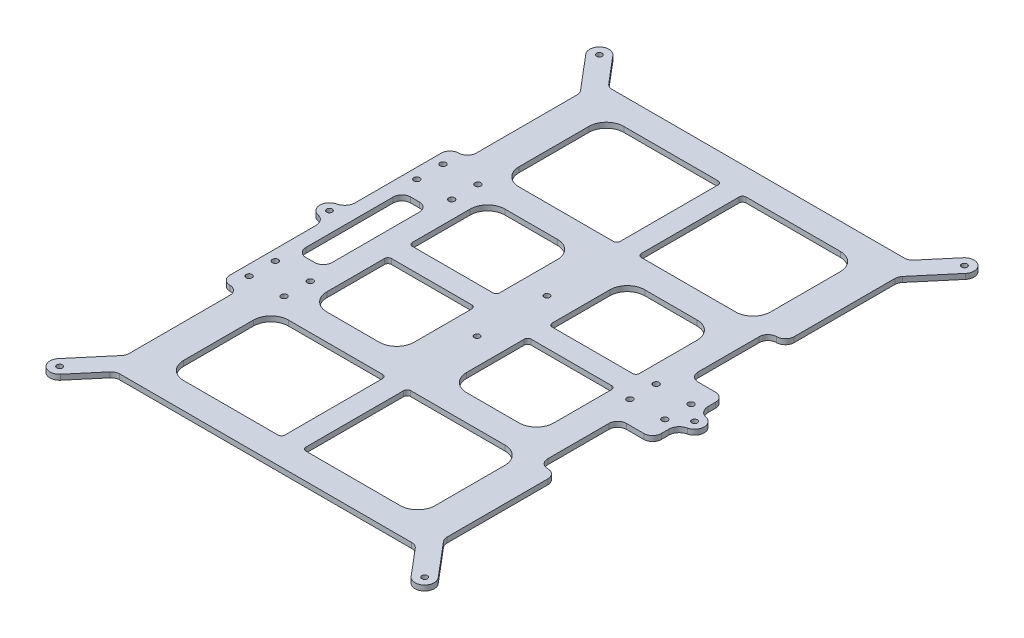
from build123d import *

# Parameters (mm, degrees)
CROQUIS1_W              = 220
CROQUIS1_H              = 320
CROQUIS1_R              = 1.7
CROQUIS1_R_2            = 1.6
SALIENTE_EXTRUIR1_DEPTH = 3
CROQUIS2_OUTSIDE_W      = 299.668
CROQUIS2_OUTSIDE_H      = 399.668
CORTAR_EXTRUIR1_DEPTH   = 3
REDONDEO1_R             = 5
CROQUIS3_W              = 20
CROQUIS3_H              = 45
CORTAR_EXTRUIR2_DEPTH   = 3
CROQUIS4_W              = 15
CROQUIS4_H              = 60
CORTAR_EXTRUIR3_DEPTH   = 3
REDONDEO2_R             = 5


with BuildPart() as part:
    # Croquis1 → Saliente-Extruir1 (new body)
    with BuildSketch(Plane(origin=(0, 0, 0), x_dir=(1, 0, 0), z_dir=(0, 1, 0))):
        with Locations((110, 160)):
            Rectangle(CROQUIS1_W, CROQUIS1_H)
        with Locations(Location((185, 167.5, 0), (0, 0, 270))):
            Circle(CROQUIS1_R, mode=Mode.SUBTRACT)
        with Locations(Location((205, 167.5, 0), (0, 0, 270))):
            Circle(CROQUIS1_R, mode=Mode.SUBTRACT)
        with Locations(Location((185, 152.5, 0), (0, 0, 90))):
            Circle(CROQUIS1_R, mode=Mode.SUBTRACT)
        with Locations(Location((205, 152.5, 0), (0, 0, 90))):
            Circle(CROQUIS1_R, mode=Mode.SUBTRACT)
        with Locations(Location((35, 215.5, 0), (0, 0, 270))):
            Circle(CROQUIS1_R, mode=Mode.SUBTRACT)
        with Locations(Location((35, 200.5, 0), (0, 0, 270))):
            Circle(CROQUIS1_R, mode=Mode.SUBTRACT)
        with Locations(Location((35, 119.5, 0), (0, 0, 90))):
            Circle(CROQUIS1_R, mode=Mode.SUBTRACT)
        with Locations(Location((35, 104.5, 0), (0, 0, 90))):
            Circle(CROQUIS1_R, mode=Mode.SUBTRACT)
        with Locations(Location((5.5, 314.5, 0), (0, 0, 270))):
            Circle(CROQUIS1_R_2, mode=Mode.SUBTRACT)
        with Locations(Location((214.5, 314.5, 0), (0, 0, 90))):
            Circle(CROQUIS1_R_2, mode=Mode.SUBTRACT)
        with Locations(Location((214.5, 5.5, 0), (0, 0, 270))):
            Circle(CROQUIS1_R_2, mode=Mode.SUBTRACT)
        with Locations(Location((5.5, 5.5, 0), (0, 0, 90))):
            Circle(CROQUIS1_R_2, mode=Mode.SUBTRACT)
        with Locations(Location((15, 200.5, 0), (0, 0, 90))):
            Circle(CROQUIS1_R, mode=Mode.SUBTRACT)
        with Locations(Location((15, 215.5, 0), (0, 0, 90))):
            Circle(CROQUIS1_R, mode=Mode.SUBTRACT)
        with Locations(Location((15, 104.5, 0), (0, 0, 270))):
            Circle(CROQUIS1_R, mode=Mode.SUBTRACT)
        with Locations(Location((15, 119.5, 0), (0, 0, 270))):
            Circle(CROQUIS1_R, mode=Mode.SUBTRACT)
        with Locations(Location((110, 180, 0), (0, 0, 270))):
            Circle(CROQUIS1_R_2, mode=Mode.SUBTRACT)
        with Locations(Location((110, 140, 0), (0, 0, 90))):
            Circle(CROQUIS1_R_2, mode=Mode.SUBTRACT)
        with Locations(Location((5.5, 160, 0), (0, 0, 270))):
            Circle(CROQUIS1_R_2, mode=Mode.SUBTRACT)
        with Locations(Location((214.5, 160, 0), (0, 0, 90))):
            Circle(CROQUIS1_R_2, mode=Mode.SUBTRACT)
    extrude(amount=SALIENTE_EXTRUIR1_DEPTH)

    # Croquis2 outside → Cortar-Extruir1 (cut)
    # profile 1 of 9: a face of its own
    with BuildSketch(Plane(origin=(0, 3, 0), x_dir=(1, 0, 0), z_dir=(0, 1, 0))):
        with Locations((110, 160)):
            Rectangle(CROQUIS2_OUTSIDE_W, CROQUIS2_OUTSIDE_H)
        with BuildLine():
            Line((9, 148.77502784), (9, 94.5))
            Line((9, 94.5), (19, 94.5))
            Line((19, 94.5), (19, 30))
            Line((19, 30), (1.298802547, 9.049639413))
            ThreePointArc((1.298802547, 9.049639413), (1.950360587, 1.298802547), (9.701197453, 1.950360587))
            Line((9.701197453, 1.950360587), (24.106631311, 19))
            Line((24.106631311, 19), (195.893368689, 19))
            Line((195.893368689, 19), (210.298802547, 1.950360587))
            ThreePointArc((210.298802547, 1.950360587), (218.049639413, 1.298802547), (218.701197453, 9.049639413))
            Line((218.701197453, 9.049639413), (201, 30))
            Line((201, 30), (201, 94.5))
            Line((201, 94.5), (211, 94.5))
            Line((211, 94.5), (211, 148.77502784))
            ThreePointArc((211, 148.77502784), (212.318863014, 152.528287293), (215.695652174, 154.631535054))
            ThreePointArc((215.695652174, 154.631535054), (220, 160), (215.695652174, 165.368464946))
            ThreePointArc((215.695652174, 165.368464946), (212.318863014, 167.471712707), (211, 171.22497216))
            Line((211, 171.22497216), (211, 225.5))
            Line((211, 225.5), (201, 225.5))
            Line((201, 225.5), (201, 290))
            Line((201, 290), (218.701197453, 310.950360587))
            ThreePointArc((218.701197453, 310.950360587), (218.049639413, 318.701197453), (210.298802547, 318.049639413))
            Line((210.298802547, 318.049639413), (195.893368689, 301))
            Line((195.893368689, 301), (24.106631311, 301))
            Line((24.106631311, 301), (9.701197453, 318.049639413))
            ThreePointArc((9.701197453, 318.049639413), (1.950360587, 318.701197453), (1.298802547, 310.950360587))
            Line((1.298802547, 310.950360587), (19, 290))
            Line((19, 290), (19, 225.5))
            Line((19, 225.5), (9, 225.5))
            Line((9, 225.5), (9, 171.22497216))
            ThreePointArc((9, 171.22497216), (7.681136986, 167.471712707), (4.304347826, 165.368464946))
            ThreePointArc((4.304347826, 165.368464946), (0, 160), (4.304347826, 154.631535054))
            ThreePointArc((4.304347826, 154.631535054), (7.681136986, 152.528287293), (9, 148.77502784))
        make_face(mode=Mode.SUBTRACT)
    # profile 2 of 9: a face of its own
    with BuildSketch(Plane(origin=(0, 3, 0), x_dir=(1, 0, 0), z_dir=(0, 1, 0))):
        with BuildLine():
            Line((182, 276), (182, 236))
            ThreePointArc((182, 236), (179.071067812, 228.928932188), (172, 226))
            Line((172, 226), (118, 226))
            ThreePointArc((118, 226), (116.585786438, 226.585786438), (116, 228))
            Line((116, 228), (116, 284))
            ThreePointArc((116, 284), (116.585786438, 285.414213562), (118, 286))
            Line((118, 286), (172, 286))
            ThreePointArc((172, 286), (179.071067812, 283.071067812), (182, 276))
        make_face()
    # profile 3 of 9: a face of its own
    with BuildSketch(Plane(origin=(0, 3, 0), x_dir=(1, 0, 0), z_dir=(0, 1, 0))):
        with BuildLine():
            Line((102, 286), (48, 286))
            ThreePointArc((48, 286), (40.928932188, 283.071067812), (38, 276))
            Line((38, 276), (38, 236))
            ThreePointArc((38, 236), (40.928932188, 228.928932188), (48, 226))
            Line((48, 226), (102, 226))
            ThreePointArc((102, 226), (103.414213562, 226.585786438), (104, 228))
            Line((104, 228), (104, 284))
            ThreePointArc((104, 284), (103.414213562, 285.414213562), (102, 286))
        make_face()
    # profile 4 of 9: a face of its own
    with BuildSketch(Plane(origin=(0, 3, 0), x_dir=(1, 0, 0), z_dir=(0, 1, 0))):
        with BuildLine():
            Line((102, 94), (48, 94))
            ThreePointArc((48, 94), (40.928932188, 91.071067812), (38, 84))
            Line((38, 84), (38, 44))
            ThreePointArc((38, 44), (40.928932188, 36.928932188), (48, 34))
            Line((48, 34), (102, 34))
            ThreePointArc((102, 34), (103.414213562, 34.585786438), (104, 36))
            Line((104, 36), (104, 92))
            ThreePointArc((104, 92), (103.414213562, 93.414213562), (102, 94))
        make_face()
    # profile 5 of 9: a face of its own
    with BuildSketch(Plane(origin=(0, 3, 0), x_dir=(1, 0, 0), z_dir=(0, 1, 0))):
        with BuildLine():
            Line((116, 36), (116, 92))
            ThreePointArc((116, 92), (116.585786438, 93.414213562), (118, 94))
            Line((118, 94), (172, 94))
            ThreePointArc((172, 94), (179.071067812, 91.071067812), (182, 84))
            Line((182, 84), (182, 44))
            ThreePointArc((182, 44), (179.071067812, 36.928932188), (172, 34))
            Line((172, 34), (118, 34))
            ThreePointArc((118, 34), (116.585786438, 34.585786438), (116, 36))
        make_face()
    # profile 6 of 9: a face of its own
    with BuildSketch(Plane(origin=(0, 3, 0), x_dir=(1, 0, 0), z_dir=(0, 1, 0))):
        with BuildLine():
            Line((45, 152), (45, 119))
            ThreePointArc((45, 119), (47.928932188, 111.928932188), (55, 109))
            Line((55, 109), (85, 109))
            ThreePointArc((85, 109), (92.071067812, 111.928932188), (95, 119))
            Line((95, 119), (95, 152))
            ThreePointArc((95, 152), (94.414213562, 153.414213562), (93, 154))
            Line((93, 154), (47, 154))
            ThreePointArc((47, 154), (45.585786438, 153.414213562), (45, 152))
        make_face()
    # profile 7 of 9: a face of its own
    with BuildSketch(Plane(origin=(0, 3, 0), x_dir=(1, 0, 0), z_dir=(0, 1, 0))):
        with BuildLine():
            Line((93, 166), (47, 166))
            ThreePointArc((47, 166), (45.585786438, 166.585786438), (45, 168))
            Line((45, 168), (45, 201))
            ThreePointArc((45, 201), (47.928932188, 208.071067812), (55, 211))
            Line((55, 211), (85, 211))
            ThreePointArc((85, 211), (92.071067812, 208.071067812), (95, 201))
            Line((95, 201), (95, 168))
            ThreePointArc((95, 168), (94.414213562, 166.585786438), (93, 166))
        make_face()
    # profile 8 of 9: a face of its own
    with BuildSketch(Plane(origin=(0, 3, 0), x_dir=(1, 0, 0), z_dir=(0, 1, 0))):
        with BuildLine():
            Line((135, 109), (165, 109))
            ThreePointArc((165, 109), (172.071067812, 111.928932188), (175, 119))
            Line((175, 119), (175, 152))
            ThreePointArc((175, 152), (174.414213562, 153.414213562), (173, 154))
            Line((173, 154), (127, 154))
            ThreePointArc((127, 154), (125.585786438, 153.414213562), (125, 152))
            Line((125, 152), (125, 119))
            ThreePointArc((125, 119), (127.928932188, 111.928932188), (135, 109))
        make_face()
    # profile 9 of 9: a face of its own
    with BuildSketch(Plane(origin=(0, 3, 0), x_dir=(1, 0, 0), z_dir=(0, 1, 0))):
        with BuildLine():
            Line((127, 166), (173, 166))
            ThreePointArc((173, 166), (174.414213562, 166.585786438), (175, 168))
            Line((175, 168), (175, 201))
            ThreePointArc((175, 201), (172.071067812, 208.071067812), (165, 211))
            Line((165, 211), (135, 211))
            ThreePointArc((135, 211), (127.928932188, 208.071067812), (125, 201))
            Line((125, 201), (125, 168))
            ThreePointArc((125, 168), (125.585786438, 166.585786438), (127, 166))
        make_face()
    extrude(amount=-CORTAR_EXTRUIR1_DEPTH, mode=Mode.SUBTRACT)

    # Redondeo1
    redondeo1_edges = [part.edges().sort_by_distance(p)[0] for p in [
        (9, 1.5, -225.5),
        (9, 1.5, -94.5),
        (24.106631311, 1.5, -301),
        (195.893368689, 1.5, -301),
        (201, 1.5, -290),
        (201, 1.5, -30),
        (195.893368689, 1.5, -19),
        (24.106631311, 1.5, -19),
        (19, 1.5, -30),
        (19, 1.5, -94.5),
        (19, 1.5, -290),
        (19, 1.5, -225.5),
    ]]
    fillet(redondeo1_edges, radius=REDONDEO1_R - 0.0001)  # a hair under: the kernel refuses the full size

    # Croquis3 → Cortar-Extruir2 (cut)
    with BuildSketch(Plane(origin=(0, 3, 0), x_dir=(1, 0, 0), z_dir=(0, 1, 0))):
        with Locations((201, 203)):
            Rectangle(CROQUIS3_W, CROQUIS3_H)
        with Locations((201, 117)):
            Rectangle(CROQUIS3_W, CROQUIS3_H)
    extrude(amount=-CORTAR_EXTRUIR2_DEPTH, mode=Mode.SUBTRACT)

    # Croquis4 → Cortar-Extruir3 (cut)
    with BuildSketch(Plane(origin=(0, 3, 0), x_dir=(1, 0, 0), z_dir=(0, 1, 0))):
        with Locations((24.5, 160)):
            Rectangle(CROQUIS4_W, CROQUIS4_H)
    extrude(amount=-CORTAR_EXTRUIR3_DEPTH, mode=Mode.SUBTRACT)

    # Redondeo2
    redondeo2_edges = [part.edges().sort_by_distance(p)[0] for p in [
        (201, 1.5, -94.5),
        (191, 1.5, -94.5),
        (191, 1.5, -139.5),
        (211, 1.5, -139.5),
        (211, 1.5, -180.5),
        (191, 1.5, -180.5),
        (191, 1.5, -225.5),
        (201, 1.5, -225.5),
        (32, 1.5, -190),
        (17, 1.5, -190),
        (17, 1.5, -130),
        (32, 1.5, -130),
    ]]
    fillet(redondeo2_edges, radius=REDONDEO2_R - 0.0001)  # a hair under: the kernel refuses the full size


solid = part.part
